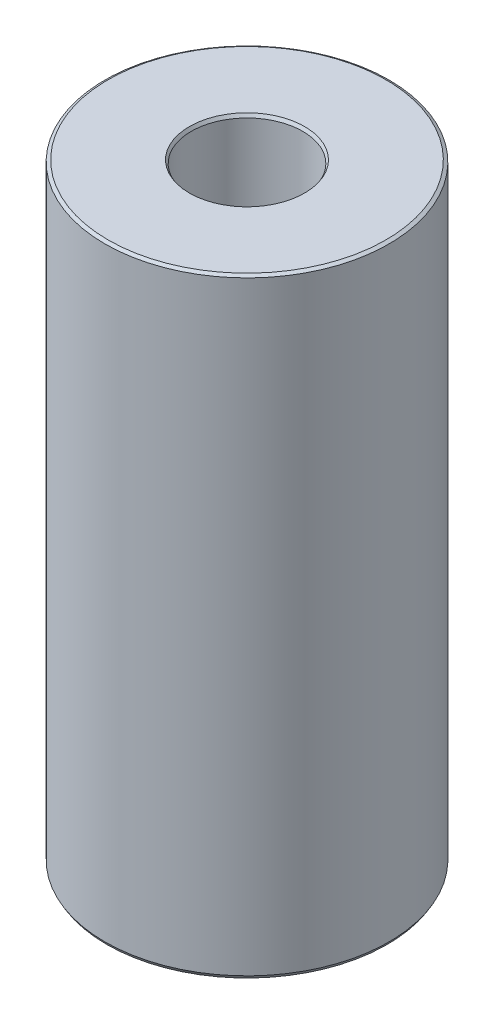
from build123d import *
from OCP.BRepFilletAPI import BRepFilletAPI_MakeChamfer

# Parameters (mm, degrees)
SKETCH1_R           = 22.5
BOSS_EXTRUDE1_DEPTH = 96.547915468
SKETCH2_R           = 8.837197363
CUT_EXTRUDE1_DEPTH  = 102.65628353
CHAMFER1_SIZE       = 0.292055753
CHAMFER1_SIZE2      = 0.505855403


with BuildPart() as part:
    # Sketch1 → Boss-Extrude1 (new body)
    with BuildSketch(Plane(origin=(0, 0, 0), x_dir=(1, 0, 0), z_dir=(0, 1, 0))):
        Circle(SKETCH1_R)
    extrude(amount=BOSS_EXTRUDE1_DEPTH)

    # Sketch2 → Cut-Extrude1 (cut, through all)
    with BuildSketch(Plane(origin=(0, 0, 0), x_dir=(1, 0, 0), z_dir=(0, 1, 0))):
        Circle(SKETCH2_R)
    extrude(amount=CUT_EXTRUDE1_DEPTH, mode=Mode.SUBTRACT)

    # Chamfer1: one chamfer whose edges measure the first distance from different faces: ONE call of the kernel's chamfer builder (chamfer() names one face for all edges)
    chamfer1_edges_1 = [part.edges().sort_by_distance(p)[0] for p in [
        (-8.837197363, 96.547915468, 0),
    ]]
    chamfer1_side_1 = [part.faces().sort_by_distance(p)[0] for p in [
        (-21.863603897, 96.547915468, 0),
    ]]
    chamfer1_edges_2 = [part.edges().sort_by_distance(p)[0] for p in [
        (-8.837197363, 0, 0),
    ]]
    chamfer1_side_2 = [part.faces().sort_by_distance(p)[0] for p in [
        (-8.837197363, 48.273957734, 0),
    ]]
    chamfer1_edges_3 = [part.edges().sort_by_distance(p)[0] for p in [
        (-22.5, 0, 0),
    ]]
    chamfer1_side_3 = [part.faces().sort_by_distance(p)[0] for p in [
        (-21.863603897, 0, 0),
    ]]
    chamfer1_edges_4 = [part.edges().sort_by_distance(p)[0] for p in [
        (-22.5, 96.547915468, 0),
    ]]
    chamfer1_side_4 = [part.faces().sort_by_distance(p)[0] for p in [
        (-22.5, 48.273957734, 0),
    ]]
    chamfer1 = BRepFilletAPI_MakeChamfer(part.part.solid().wrapped)
    for e in chamfer1_edges_1:
        chamfer1.Add(CHAMFER1_SIZE, CHAMFER1_SIZE2, e.wrapped, chamfer1_side_1[0].wrapped)  # the first distance lies on this face
    for e in chamfer1_edges_2:
        chamfer1.Add(CHAMFER1_SIZE, CHAMFER1_SIZE2, e.wrapped, chamfer1_side_2[0].wrapped)  # the first distance lies on this face
    for e in chamfer1_edges_3:
        chamfer1.Add(CHAMFER1_SIZE, CHAMFER1_SIZE2, e.wrapped, chamfer1_side_3[0].wrapped)  # the first distance lies on this face
    for e in chamfer1_edges_4:
        chamfer1.Add(CHAMFER1_SIZE, CHAMFER1_SIZE2, e.wrapped, chamfer1_side_4[0].wrapped)  # the first distance lies on this face
    add(Compound.cast(chamfer1.Shape()), mode=Mode.REPLACE)


solid = part.part
